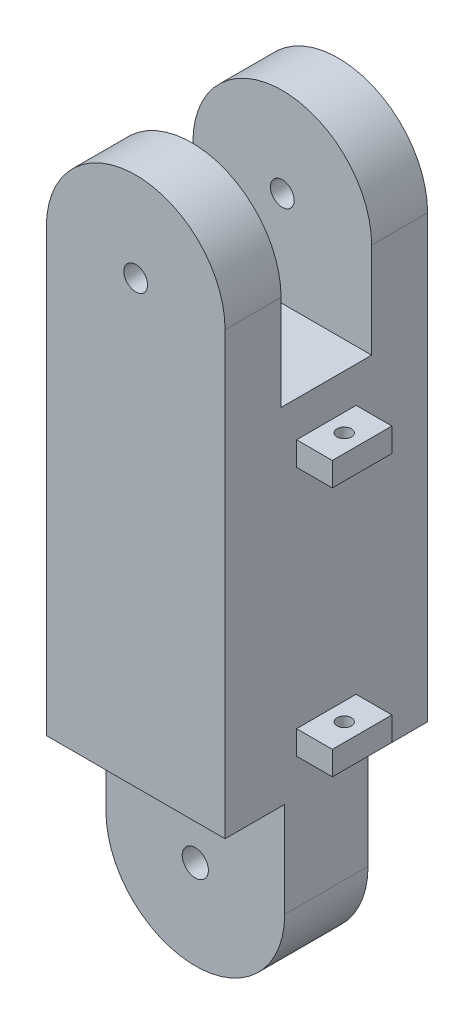
from build123d import *

# Parameters (mm, degrees)
LINK1_BODY_DEPTH       = 8.5
TONGUE_CUT_DEPTH       = 56.258483512
TONGUE_CUT_DEPTH_BACK  = 56.258483512
SKETCH1_W              = 5.5
SKETCH1_H              = 15.998130079
SLOT_CUT_DEPTH         = 54.709868739
SLOT_CUT_DEPTH_BACK    = 54.709868739
SKETCH2_W              = 7.6
SKETCH2_H              = 18
PIN_HOLES_DEPTH        = 54.709868739
PIN_HOLES_DEPTH_BACK   = 54.709868739
SKETCH3_R              = 1.1
SKETCH3_R_2            = 1
SKETCH4_W              = 3.5
SKETCH4_H              = 2
GUIDE_BLOCK_1_DEPTH    = 2.5
SKETCH5_W              = 3.5
SKETCH5_H              = 2
GUIDE_BLOCK_2_DEPTH    = 2.5
CORD_GUIDES_DEPTH      = 55.210352272
CORD_GUIDES_DEPTH_BACK = 55.210352272
SKETCH6_R              = 0.6


with BuildPart() as part:
    # Link1_Outline → Link1_Body (new, symmetric)
    with BuildSketch(Plane.XY):
        with BuildLine():
            Line((-7.5, 0), (-7.5, 45))
            ThreePointArc((-7.5, 45), (0, 52.5), (7.5, 45))
            Line((7.5, 45), (7.5, 0))
            ThreePointArc((7.5, 0), (0, -7.5), (-7.5, 0))
        make_face()
    extrude(amount=LINK1_BODY_DEPTH, both=True)

    # Sketch1 → Tongue_Cut (cut, two sides: drawn at the far end of the back side and taken through both)
    with BuildSketch(Plane(origin=(7.5, 0, 0), x_dir=(0, 0, -1), z_dir=(1, 0, 0)).offset(-TONGUE_CUT_DEPTH_BACK)):
        with Locations((6.25, -0.00093496)):
            Rectangle(SKETCH1_W, SKETCH1_H)
        with Locations((-6.25, -0.00093496)):
            Rectangle(SKETCH1_W, SKETCH1_H)
    extrude(amount=TONGUE_CUT_DEPTH + TONGUE_CUT_DEPTH_BACK, mode=Mode.SUBTRACT)

    # Sketch2 → Slot_Cut (cut, two sides: drawn at the far end of the back side and taken through both)
    with BuildSketch(Plane(origin=(0, 0, 0), x_dir=(0, 0, -1), z_dir=(1, 0, 0)).offset(-SLOT_CUT_DEPTH_BACK)):
        with Locations((0, 46)):
            Rectangle(SKETCH2_W, SKETCH2_H)
    extrude(amount=SLOT_CUT_DEPTH + SLOT_CUT_DEPTH_BACK, mode=Mode.SUBTRACT)

    # Sketch3 → Pin_Holes (cut, two sides: drawn at the far end of the back side and taken through both)
    with BuildSketch(Plane.XY.offset(-PIN_HOLES_DEPTH_BACK)):
        Circle(SKETCH3_R)
        with Locations((0, 45)):
            Circle(SKETCH3_R_2)
    extrude(amount=PIN_HOLES_DEPTH + PIN_HOLES_DEPTH_BACK, mode=Mode.SUBTRACT)

    # Sketch4 → Guide_Block_1 (add, symmetric)
    with BuildSketch(Plane.XY):
        with Locations((8.75, 12)):
            Rectangle(SKETCH4_W, SKETCH4_H)
    extrude(amount=GUIDE_BLOCK_1_DEPTH, both=True)

    # Sketch5 → Guide_Block_2 (add, symmetric)
    with BuildSketch(Plane.XY):
        with Locations((8.750585387, 33)):
            Rectangle(SKETCH5_W, SKETCH5_H)
    extrude(amount=GUIDE_BLOCK_2_DEPTH, both=True)

    # Sketch6 → Cord_Guides (cut, two sides: drawn at the far end of the back side and taken through both)
    with BuildSketch(Plane(origin=(0, 0, 0), x_dir=(1, 0, 0), z_dir=(0, 1, 0)).offset(-CORD_GUIDES_DEPTH_BACK)):
        with Locations((9, 0)):
            Circle(SKETCH6_R)
    extrude(amount=CORD_GUIDES_DEPTH + CORD_GUIDES_DEPTH_BACK, mode=Mode.SUBTRACT)


solid = part.part
